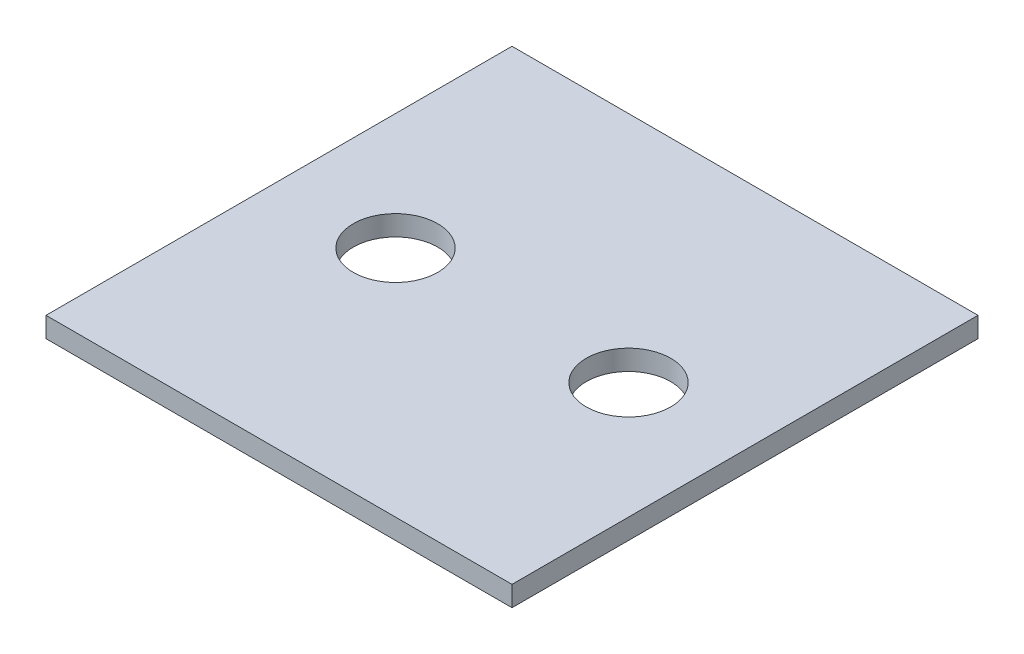
from build123d import *

# Parameters (mm, degrees)
SKETCH1_W           = 276
SKETCH1_H           = 276
SKETCH1_R           = 25
BOSS_EXTRUDE1_DEPTH = 12


with BuildPart() as part:
    # Sketch1 → Boss-Extrude1 (new body)
    with BuildSketch(Plane(origin=(0, 0, 0), x_dir=(1, 0, 0), z_dir=(0, 1, 0))):
        with Locations((138, 138)):
            Rectangle(SKETCH1_W, SKETCH1_H)
        with Locations((69, 138)):
            Circle(SKETCH1_R, mode=Mode.SUBTRACT)
        with Locations((207, 138)):
            Circle(SKETCH1_R, mode=Mode.SUBTRACT)
    extrude(amount=BOSS_EXTRUDE1_DEPTH)


solid = part.part
